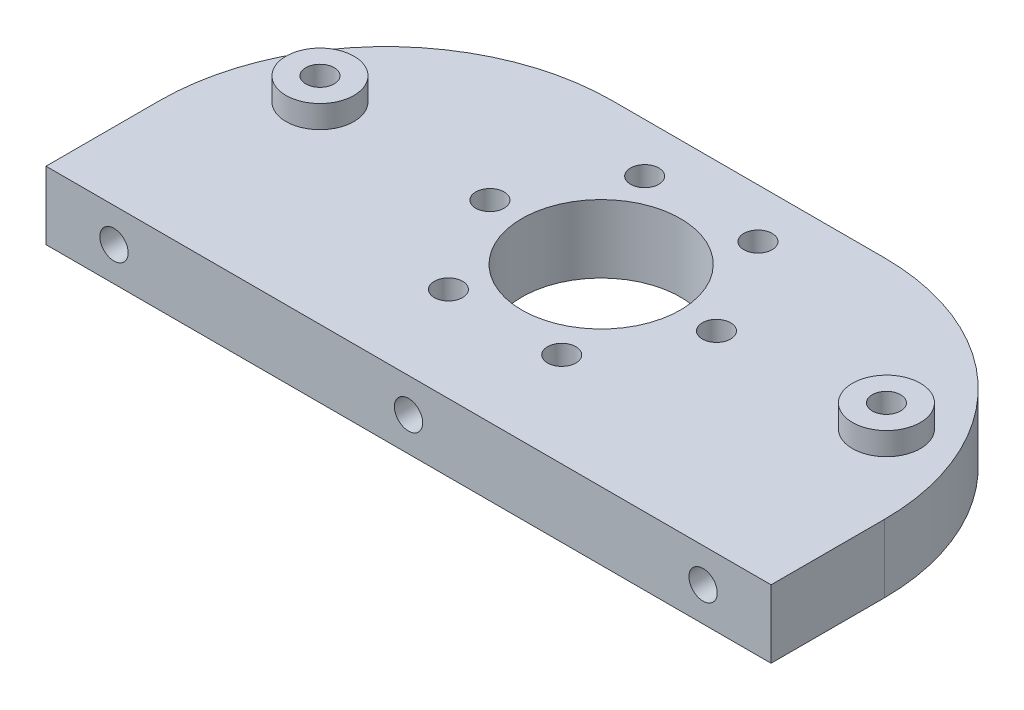
from build123d import *

# Parameters (mm, degrees)
SKETCH1_W                        = 32
SKETCH1_H                        = 15
BOSS_EXTRUDE1_DEPTH              = 3
SKETCH2_R                        = 3.5
CUT_EXTRUDE1_DEPTH               = 4
M1_6X0_35_TAPPED_HOLE2_D         = 1.25
SKETCH21_R                       = 1.5
BOSS_EXTRUDE4_DEPTH              = 1
M1_6X0_35_TAPPED_HOLE3_OUTLINE_R = 0.625
M1_6X0_35_TAPPED_HOLE3_DEPTH     = 4
FILLET1_R                        = 10
M1_6X0_35_TAPPED_HOLE4_D         = 1.25
M1_6X0_35_TAPPED_HOLE4_DEPTH     = 3
M1_6X0_35_TAPPED_HOLE4_TIP       = 0.375537887


# Read off the part's stored shape, not the designer's step: M1.6x0.35 Tapped Hole3
with BuildPart() as part:
    # Sketch1 → Boss-Extrude1 (new body)
    with BuildSketch(Plane(origin=(0, 0, 0), x_dir=(1, 0, 0), z_dir=(0, 1, 0))):
        with Locations((-37.365810967, -15.175330849)):
            Rectangle(SKETCH1_W, SKETCH1_H)
    extrude(amount=BOSS_EXTRUDE1_DEPTH)

    # Sketch2 → Cut-Extrude1 (cut)
    with BuildSketch(Plane(origin=(0, 3, 0), x_dir=(1, 0, 0), z_dir=(0, 1, 0))):
        with Locations(Location((-37.365810967, -14.175330849, 0), (0, 0, 270))):
            Circle(SKETCH2_R)
    extrude(amount=-CUT_EXTRUDE1_DEPTH, mode=Mode.SUBTRACT)

    # M1.6x0.35 Tapped Hole2 (through all)
    with Locations(Plane(origin=(0, 3, 0), x_dir=(1, 0, 0), z_dir=(0, 1, 0))):
        with Locations((-34.774464311, -18.505457868), (-39.774464311, -18.505457868), (-42.274464311, -14.175330849), (-39.774464311, -9.84520383), (-34.774464311, -9.84520383), (-32.274464311, -14.175330849)):
            Hole(M1_6X0_35_TAPPED_HOLE2_D / 2)

    # Sketch21 → Boss-Extrude4 (add)
    with BuildSketch(Plane(origin=(0, 3, 0), x_dir=(1, 0, 0), z_dir=(0, 1, 0))):
        with Locations(Location((-49.774464311, -14.175330849, 0), (0, 0, 270))):
            Circle(SKETCH21_R)
        with Locations(Location((-24.774464311, -14.175330849, 0), (0, 0, 270))):
            Circle(SKETCH21_R)
    extrude(amount=BOSS_EXTRUDE4_DEPTH)

    # M1.6x0.35 Tapped Hole3 outline → M1.6x0.35 Tapped Hole3 (cut)
    with BuildSketch(Plane(origin=(0, 0, 0), x_dir=(1, 0, 0), z_dir=(0, 1, 0))):
        with Locations((-24.774464311, -14.175330849)):
            Circle(M1_6X0_35_TAPPED_HOLE3_OUTLINE_R)
        with Locations((-49.774464311, -14.175330849)):
            Circle(M1_6X0_35_TAPPED_HOLE3_OUTLINE_R)
    extrude(amount=M1_6X0_35_TAPPED_HOLE3_DEPTH, mode=Mode.SUBTRACT)

    # Fillet1
    fillet1_edges = [part.edges().sort_by_distance(p)[0] for p in [
        (-53.365810967, 1.5, 7.675330849),
        (-21.365810967, 1.5, 7.675330849),
    ]]
    fillet(fillet1_edges, radius=FILLET1_R)

    # M1.6x0.35 Tapped Hole4
    with Locations(Plane.XY.offset(22.675330849)):
        with Locations((-50.365810967, 1.5), (-24.365810967, 1.5), (-37.365810967, 1.5)):
            Hole(M1_6X0_35_TAPPED_HOLE4_D / 2, depth=M1_6X0_35_TAPPED_HOLE4_DEPTH)
            with Locations((0, 0, -(M1_6X0_35_TAPPED_HOLE4_DEPTH + M1_6X0_35_TAPPED_HOLE4_TIP / 2))):  # 118° drill point
                Cone(0, M1_6X0_35_TAPPED_HOLE4_D / 2, M1_6X0_35_TAPPED_HOLE4_TIP, mode=Mode.SUBTRACT)


solid = part.part
